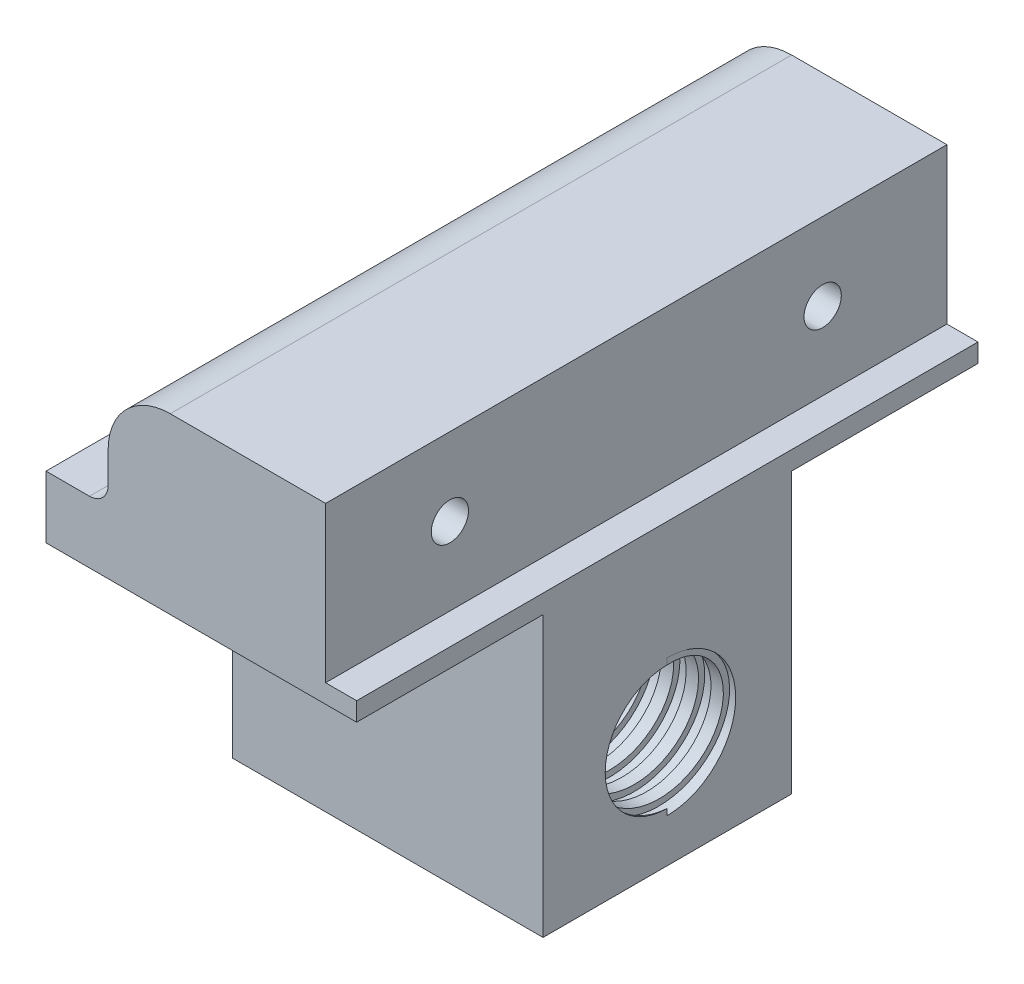
from build123d import *

# Parameters (mm, degrees)
BOSS_EXTRUDE1_DEPTH         = 50
SKETCH2_W                   = 50
SKETCH2_H                   = 40
BOSS_EXTRUDE2_DEPTH         = 45
SKETCH3_R                   = 10
CUT_EXTRUDE1_DEPTH          = 93.436536572
CUT_SWEEP1_PITCH            = 4
HOLE1_D                     = 5
HOLE1_DEPTH                 = 13
HOLE1_CBORE_D               = 6
HOLE1_CBORE_DEPTH           = 10
HOLE1_TIP                   = 1.502151548
HOLE1_ON_FACE_2_D           = 5
HOLE1_ON_FACE_2_DEPTH       = 13
HOLE1_ON_FACE_2_CBORE_D     = 6
HOLE1_ON_FACE_2_CBORE_DEPTH = 10
HOLE1_ON_FACE_2_TIP         = 1.502151548


with BuildPart() as part:
    # Sketch1 → Boss-Extrude1 (new, symmetric)
    with BuildSketch(Plane.XY):
        with BuildLine():
            Line((-25.773641308, -14.535815215), (24.226358692, -14.535815215))
            Line((24.226358692, -14.535815215), (24.226358692, -11.535815215))
            Line((24.226358692, -11.535815215), (19.226358692, -11.535815215))
            Line((19.226358692, -11.535815215), (19.226358692, 13.464184785))
            Line((19.226358692, 13.464184785), (-5.773641308, 13.464184785))
            ThreePointArc((-5.773641308, 13.464184785), (-12.84470912, 10.535252597), (-15.773641308, 3.464184785))
            Line((-15.773641308, 3.464184785), (-15.773641308, -1.535815215))
            ThreePointArc((-15.773641308, -1.535815215), (-16.652320964, -3.657135559), (-18.773641308, -4.535815215))
            Line((-18.773641308, -4.535815215), (-25.773641308, -4.535815215))
            Line((-25.773641308, -4.535815215), (-25.773641308, -14.535815215))
        make_face()
    extrude(amount=BOSS_EXTRUDE1_DEPTH, both=True)

    # Sketch2 → Boss-Extrude2 (add)
    with BuildSketch(Plane.XZ.offset(14.535815215)):
        with Locations((-0.773641308, 0)):
            Rectangle(SKETCH2_W, SKETCH2_H)
    extrude(amount=BOSS_EXTRUDE2_DEPTH)

    # Sketch3 → Cut-Extrude1 (cut, through all)
    with BuildSketch(Plane(origin=(24.226358692, 0, 0), x_dir=(0, 0, -1), z_dir=(1, 0, 0))):
        with Locations((0, -41.535815215)):
            Circle(SKETCH3_R)
    extrude(amount=-CUT_EXTRUDE1_DEPTH, mode=Mode.SUBTRACT)

    # Cut-Sweep1: arcs per turn and ends read off the stored shape
    # Cut-Sweep1: the profile of Sketch7 screwed along a right-hand helix through 14.25 turns, 12 arcs to a turn; built about Z, then put on its axis
    cut_sweep1_z = Axis((0, 0, 0), (0, 0, 1))
    cut_sweep1_corners = [(11, -0.063533362, -3.002020285), (11, 0.063533362, -4.997979715), (9, 0.063533362, -4.997979715), (9, -0.063533362, -3.002020285)]
    with BuildLine(mode=Mode.PRIVATE) as cut_sweep1_profile:
        Line(cut_sweep1_corners[0], cut_sweep1_corners[1])
        Line(cut_sweep1_corners[1], cut_sweep1_corners[2])
        Line(cut_sweep1_corners[2], cut_sweep1_corners[3])
        Line(cut_sweep1_corners[3], cut_sweep1_corners[0])
    cut_sweep1_cap = Face(cut_sweep1_profile.wire())
    cut_sweep1_turn_angles = [0, 15, 30, 45, 60, 75, 90, 105, 120, 135, 150, 165, 180, 195, 210, 225, 240, 255, 270, 285, 300, 315, 330, 345, 360]
    cut_sweep1_turn_weights = [1, 0.9659258262890683, 1, 0.9659258262890683, 1, 0.9659258262890683, 1, 0.9659258262890683, 1, 0.9659258262890683, 1, 0.9659258262890683, 1, 0.9659258262890683, 1, 0.9659258262890683, 1, 0.9659258262890683, 1, 0.9659258262890683, 1, 0.9659258262890683, 1, 0.9659258262890683, 1]
    cut_sweep1_turn_rails = [Edge.make_bspline([Vector(p[0], p[1], 0).rotate(cut_sweep1_z, cut_sweep1_turn_angles[k]) / cut_sweep1_turn_weights[k] + Vector(0, 0, p[2] + CUT_SWEEP1_PITCH * cut_sweep1_turn_angles[k] / 360) for k in range(25)], [0, 0, 0, 1, 1, 2, 2, 3, 3, 4, 4, 5, 5, 6, 6, 7, 7, 8, 8, 9, 9, 10, 10, 11, 11, 12, 12, 12], 2, cut_sweep1_turn_weights) for p in cut_sweep1_corners]
    cut_sweep1_turn_sides = [Face.make_surface_from_curves(cut_sweep1_turn_rails[p[0]], cut_sweep1_turn_rails[p[1]]) for p in [(0, 1), (1, 2), (2, 3), (3, 0)]]
    cut_sweep1_last_angles = [5040, 5055, 5070, 5085, 5100, 5115, 5130]
    cut_sweep1_last_weights = [1, 0.9659258262890683, 1, 0.9659258262890683, 1, 0.9659258262890683, 1]
    cut_sweep1_last_rails = [Edge.make_bspline([Vector(p[0], p[1], 0).rotate(cut_sweep1_z, cut_sweep1_last_angles[k]) / cut_sweep1_last_weights[k] + Vector(0, 0, p[2] + CUT_SWEEP1_PITCH * cut_sweep1_last_angles[k] / 360) for k in range(7)], [0, 0, 0, 1, 1, 2, 2, 3, 3, 3], 2, cut_sweep1_last_weights) for p in cut_sweep1_corners]
    cut_sweep1_last_sides = [Face.make_surface_from_curves(cut_sweep1_last_rails[p[0]], cut_sweep1_last_rails[p[1]]) for p in [(0, 1), (1, 2), (2, 3), (3, 0)]]
    cut_sweep1 = Plane(origin=(24.226358692, -41.535815215, 0), x_dir=(0, 0, -1), z_dir=(-1, 0, 0)) * Solid(Shell([*[p.moved(Location((0, 0, CUT_SWEEP1_PITCH * i))) for i in range(14) for p in cut_sweep1_turn_sides], *cut_sweep1_last_sides, cut_sweep1_cap, cut_sweep1_cap.rotate(cut_sweep1_z, 5130).moved(Location((0, 0, CUT_SWEEP1_PITCH * 5130 / 360)))]))
    add(cut_sweep1, mode=Mode.SUBTRACT)

    # Hole1
    with Locations(Plane(origin=(19.226358692, 0.964184785, 30), x_dir=(0, 0, 1), z_dir=(1, 0, 0))):
        with Locations((0, 0), (-60, 0)):
            CounterBoreHole(HOLE1_D / 2, HOLE1_CBORE_D / 2, HOLE1_CBORE_DEPTH, depth=HOLE1_DEPTH)
            with Locations((0, 0, -(HOLE1_DEPTH + HOLE1_TIP / 2))):  # 118° drill point
                Cone(0, HOLE1_D / 2, HOLE1_TIP, mode=Mode.SUBTRACT)

    # Hole1 on face 2
    with Locations(Plane(origin=(-0.773641308, -59.535815215, 12), x_dir=(0, 0, -1), z_dir=(0, -1, 0))):
        with Locations((0, 0), (24, 0)):
            CounterBoreHole(HOLE1_ON_FACE_2_D / 2, HOLE1_ON_FACE_2_CBORE_D / 2, HOLE1_ON_FACE_2_CBORE_DEPTH, depth=HOLE1_ON_FACE_2_DEPTH)
            with Locations((0, 0, -(HOLE1_ON_FACE_2_DEPTH + HOLE1_ON_FACE_2_TIP / 2))):  # 118° drill point
                Cone(0, HOLE1_ON_FACE_2_D / 2, HOLE1_ON_FACE_2_TIP, mode=Mode.SUBTRACT)


solid = part.part
